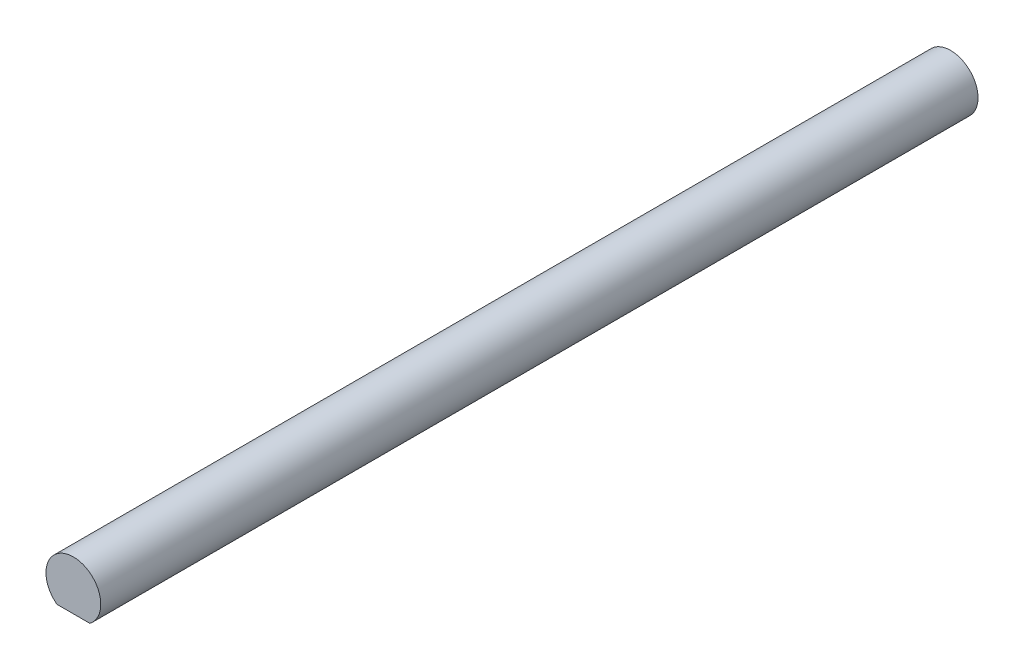
from build123d import *

# Parameters (mm, degrees)
BOSS_EXTRUDE1_DEPTH      = 50.8
BOSS_EXTRUDE1_DEPTH_BACK = 50.8


with BuildPart() as part:
    # Sketch1 → Boss-Extrude1 (new, two sides: drawn at the far end of the back side and taken through both)
    with BuildSketch(Plane.XY.offset(-BOSS_EXTRUDE1_DEPTH_BACK)):
        with BuildLine():
            Line((-1.905, -2.54), (1.905, -2.54))
            ThreePointArc((1.905, -2.54), (0, 3.175), (-1.905, -2.54))
        make_face()
    extrude(amount=BOSS_EXTRUDE1_DEPTH + BOSS_EXTRUDE1_DEPTH_BACK)


solid = part.part
